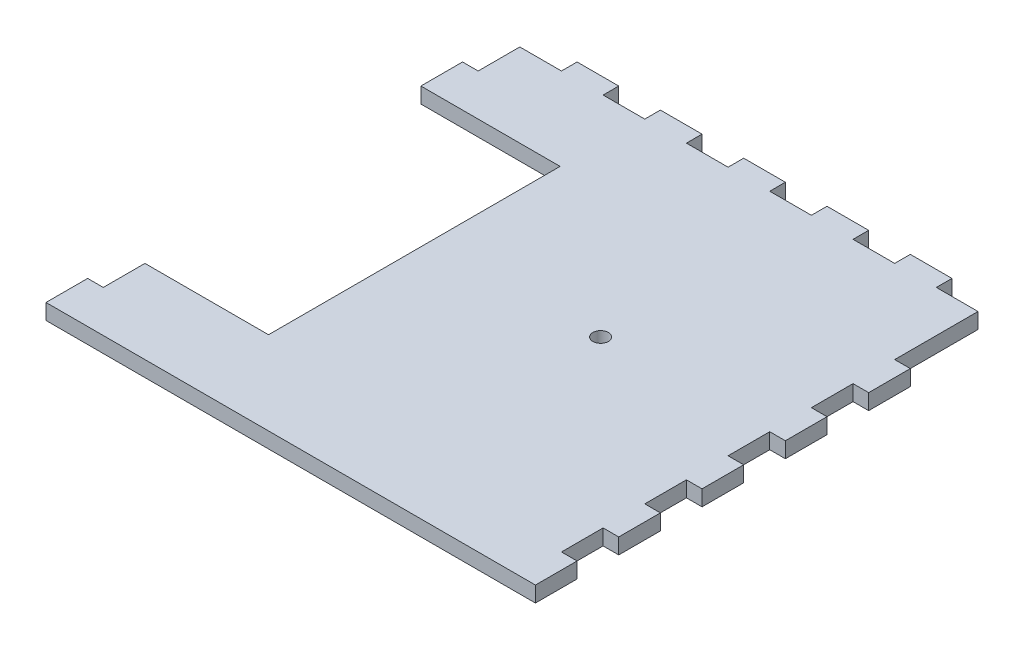
from build123d import *

# Parameters (mm, degrees)
SKETCH1_W               = 279.4
SKETCH1_H               = 279.4
BOSS_EXTRUDE1_DEPTH     = 9.525
SKETCH2_W               = 25.4
SKETCH2_H               = 9.525
BOSS_EXTRUDE2_DEPTH     = 9.525
LPATTERN1_COUNT         = 5
LPATTERN1_PITCH         = 50.8
MIRROR1_COPY_1_SKETCH_W = 25.4
MIRROR1_COPY_1_SKETCH_H = 9.525
MIRROR1_COPY_1_DEPTH    = 9.525
MIRROR1_COPY_2_SKETCH_W = 25.4
MIRROR1_COPY_2_SKETCH_H = 9.525
MIRROR1_COPY_2_DEPTH    = 9.525
MIRROR1_COPY_3_SKETCH_W = 25.4
MIRROR1_COPY_3_SKETCH_H = 9.525
MIRROR1_COPY_3_DEPTH    = 9.525
MIRROR1_COPY_4_SKETCH_W = 25.4
MIRROR1_COPY_4_SKETCH_H = 9.525
MIRROR1_COPY_4_DEPTH    = 9.525
MIRROR1_COPY_5_SKETCH_W = 25.4
MIRROR1_COPY_5_SKETCH_H = 9.525
MIRROR1_COPY_5_DEPTH    = 9.525
SKETCH3_W               = 25.4
SKETCH3_H               = 9.525
BOSS_EXTRUDE3_DEPTH     = 9.525
LPATTERN2_COUNT         = 5
LPATTERN2_PITCH         = 50.8
SKETCH6_R               = 4.7625
CUT_EXTRUDE1_DEPTH      = 212.250862424
SKETCH8_W               = 84.891093183
SKETCH8_H               = 177.8
CUT_EXTRUDE3_DEPTH      = 212.250862424
SKETCH9_W               = 25.4
SKETCH9_H               = 9.525
BOSS_EXTRUDE4_DEPTH     = 9.525


with BuildPart() as part:
    # Sketch1 → Boss-Extrude1 (new body)
    with BuildSketch(Plane(origin=(0, 0, 0), x_dir=(1, 0, 0), z_dir=(0, 1, 0))):
        Rectangle(SKETCH1_W, SKETCH1_H)
    extrude(amount=BOSS_EXTRUDE1_DEPTH)

    # Sketch2 → Boss-Extrude2 (add)
    with BuildSketch(Plane(origin=(139.7, 0, 0), x_dir=(0, 0, -1), z_dir=(1, 0, 0))):
        with Locations((-127, 4.7625)):
            Rectangle(SKETCH2_W, SKETCH2_H)
    boss_extrude2 = extrude(amount=BOSS_EXTRUDE2_DEPTH)

    # LPattern1: Boss-Extrude2 ×5
    with Locations(*[(0, 0, -i * LPATTERN1_PITCH) for i in range(1, LPATTERN1_COUNT)]):
        add(boss_extrude2)

    # Mirror1 copy 1 sketch → Mirror1 copy 1 (add)
    with BuildSketch(Plane(origin=(-139.7, 0, -50.8), x_dir=(0, 0, -1), z_dir=(-1, 0, 0))):
        with Locations((-127, -4.7625)):
            Rectangle(MIRROR1_COPY_1_SKETCH_W, MIRROR1_COPY_1_SKETCH_H)
    extrude(amount=MIRROR1_COPY_1_DEPTH)

    # Mirror1 copy 2 sketch → Mirror1 copy 2 (add)
    with BuildSketch(Plane(origin=(-139.7, 0, -101.6), x_dir=(0, 0, -1), z_dir=(-1, 0, 0))):
        with Locations((-127, -4.7625)):
            Rectangle(MIRROR1_COPY_2_SKETCH_W, MIRROR1_COPY_2_SKETCH_H)
    extrude(amount=MIRROR1_COPY_2_DEPTH)

    # Mirror1 copy 3 sketch → Mirror1 copy 3 (add)
    with BuildSketch(Plane(origin=(-139.7, 0, -152.4), x_dir=(0, 0, -1), z_dir=(-1, 0, 0))):
        with Locations((-127, -4.7625)):
            Rectangle(MIRROR1_COPY_3_SKETCH_W, MIRROR1_COPY_3_SKETCH_H)
    extrude(amount=MIRROR1_COPY_3_DEPTH)

    # Mirror1 copy 4 sketch → Mirror1 copy 4 (add)
    with BuildSketch(Plane(origin=(-139.7, 0, -203.2), x_dir=(0, 0, -1), z_dir=(-1, 0, 0))):
        with Locations((-127, -4.7625)):
            Rectangle(MIRROR1_COPY_4_SKETCH_W, MIRROR1_COPY_4_SKETCH_H)
    extrude(amount=MIRROR1_COPY_4_DEPTH)

    # Mirror1 copy 5 sketch → Mirror1 copy 5 (add)
    with BuildSketch(Plane(origin=(-139.7, 0, 0), x_dir=(0, 0, -1), z_dir=(-1, 0, 0))):
        with Locations((-127, -4.7625)):
            Rectangle(MIRROR1_COPY_5_SKETCH_W, MIRROR1_COPY_5_SKETCH_H)
    extrude(amount=MIRROR1_COPY_5_DEPTH)

    # Sketch3 → Boss-Extrude3 (add)
    with BuildSketch(Plane(origin=(0, 0, -139.7), x_dir=(-1, 0, 0), z_dir=(0, 0, -1))):
        with Locations((-101.6, 4.7625)):
            Rectangle(SKETCH3_W, SKETCH3_H)
    boss_extrude3 = extrude(amount=BOSS_EXTRUDE3_DEPTH)

    # LPattern2: Boss-Extrude3 ×5
    with Locations(*[(-i * LPATTERN2_PITCH, 0, 0) for i in range(1, LPATTERN2_COUNT)]):
        add(boss_extrude3)

    # Sketch6 → Cut-Extrude1 (cut, through all)
    with BuildSketch(Plane(origin=(0, 9.525, 0), x_dir=(1, 0, 0), z_dir=(0, 1, 0))):
        with Locations((38.1, 11.176)):
            Circle(SKETCH6_R)
    extrude(amount=-CUT_EXTRUDE1_DEPTH, mode=Mode.SUBTRACT)

    # Sketch8 → Cut-Extrude3 (cut, through all)
    with BuildSketch(Plane(origin=(0, 9.525, 0), x_dir=(1, 0, 0), z_dir=(0, 1, 0))):
        with Locations((-106.779453409, 0)):
            Rectangle(SKETCH8_W, SKETCH8_H)
    extrude(amount=-CUT_EXTRUDE3_DEPTH, mode=Mode.SUBTRACT)

    # Sketch9 → Boss-Extrude4 (add)
    with BuildSketch(Plane.ZY.offset(139.7)):
        with Locations((-101.6, 4.7625)):
            Rectangle(SKETCH9_W, SKETCH9_H)
    extrude(amount=BOSS_EXTRUDE4_DEPTH)


solid = part.part
